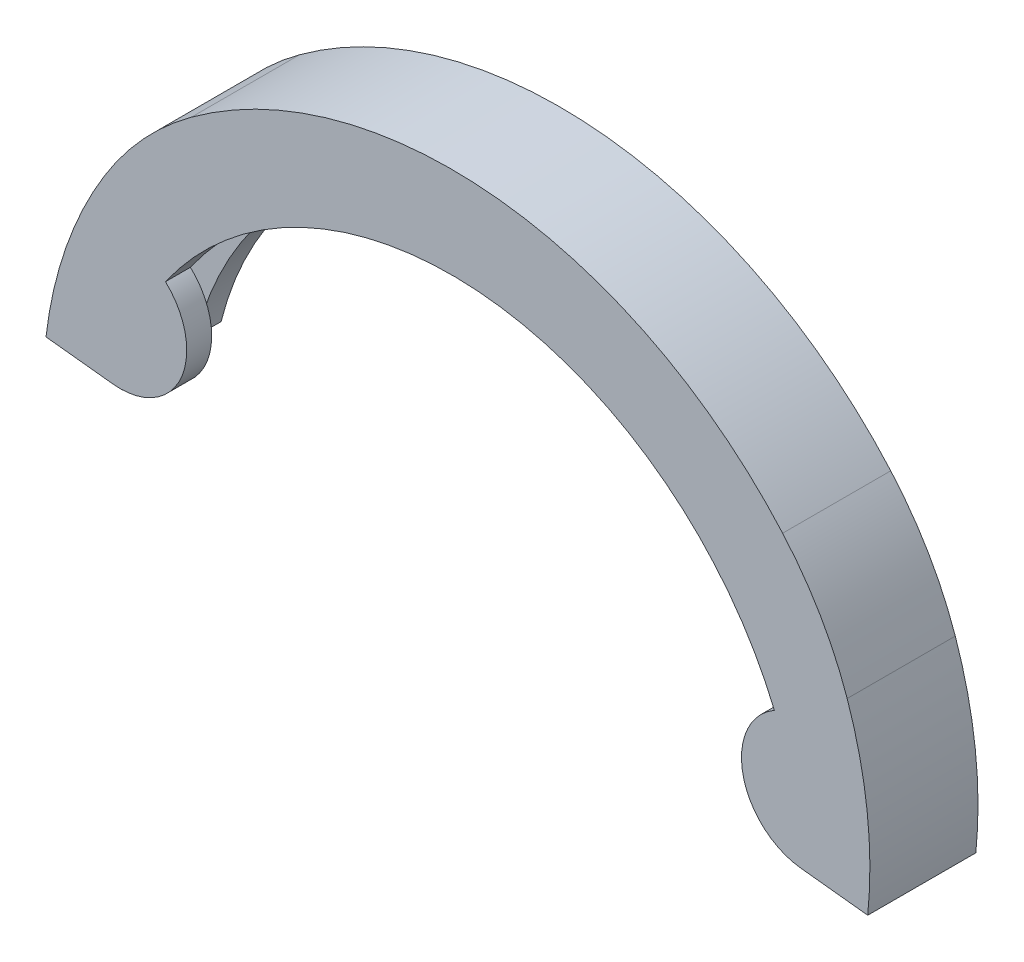
from build123d import *

# Parameters (mm, degrees)
SKETCH1_W                     = 50
SKETCH1_H                     = 7
REVOLVE5_ANGLE                = 167.5
SHELL2_T                      = 3
CUT_EXTRUDE3_DEPTH            = 77.072333999
CUT_EXTRUDE3_DEPTH_BACK       = 10
CUT_EXTRUDE4_DEPTH            = 77.072333999
CUT_EXTRUDE4_DEPTH_BACK       = 10
CUT_EXTRUDE_THIN1_DEPTH       = 77.072333999
CUT_EXTRUDE_THIN1_DEPTH_BACK  = 20
CUT_EXTRUDE_THIN2_DEPTH       = 77.072333999
CUT_EXTRUDE_THIN2_DEPTH_BACK  = 20
CUT_EXTRUDE_THIN3_DEPTH       = 76.000787866
CUT_EXTRUDE_THIN3_DEPTH_BACK  = 20
SKETCH18_R                    = 8
BOSS_EXTRUDE3_DEPTH           = 3
CUT_EXTRUDE_THIN11_DEPTH      = 76.000787866
CUT_EXTRUDE_THIN11_DEPTH_BACK = 20
CUT_EXTRUDE_THIN12_DEPTH      = 76.000787866
CUT_EXTRUDE_THIN12_DEPTH_BACK = 20
FILLET2_R                     = 40


with BuildPart() as part:
    # Sketch1 → Revolve5 (revolve)
    with BuildSketch(Plane(origin=(0, 0, 0), x_dir=(1, 0, 0), z_dir=(0, 1, 0))):
        with Locations((25, 3.5)):
            Rectangle(SKETCH1_W, SKETCH1_H)
    revolve(axis=Axis((0, 0, 0), (0, 0, 1)), revolution_arc=REVOLVE5_ANGLE)

    # Shell2
    shell2_openings = [part.faces().sort_by_distance(p)[0] for p in [
        (25, 0, -3.5),
        (-24.407400178, 5.410990348, -3.5),
    ]]
    offset(amount=SHELL2_T, openings=shell2_openings, kind=Kind.INTERSECTION)

    # Sketch11 → Cut-Extrude3 (cut, two sides: drawn at the far end of the back side and taken through both)
    with BuildSketch(Plane.XY.offset(3).offset(-CUT_EXTRUDE3_DEPTH_BACK)):
        Polygon((-295.067343662, 38.119573796), (-51.743688377, 11.471299539), (53, 0), (296.323655284, -26.648274258), (243.027106769, -513.295584826), (-348.363892177, -448.527736772), align=None)
    extrude(amount=CUT_EXTRUDE3_DEPTH + CUT_EXTRUDE3_DEPTH_BACK, mode=Mode.SUBTRACT)

    # Sketch12 → Cut-Extrude4 (cut, two sides: drawn at the far end of the back side and taken through both)
    with BuildSketch(Plane(origin=(0, 0, -10), x_dir=(-1, 0, 0), z_dir=(0, 0, -1)).offset(-CUT_EXTRUDE4_DEPTH_BACK)):
        Polygon((-296.323655284, -26.648274258), (-53, 0), (51.743688377, 11.471299539), (295.067343662, 38.119573796), (348.363892177, -448.527736772), (-243.027106769, -513.295584826), align=None)
    extrude(amount=CUT_EXTRUDE4_DEPTH + CUT_EXTRUDE4_DEPTH_BACK, mode=Mode.SUBTRACT)

    # Sketch13 → Cut-Extrude-Thin1 (cut, two sides: drawn at the far end of the back side and taken through both)
    with BuildSketch(Plane(origin=(0, 0, -10), x_dir=(-1, 0, 0), z_dir=(0, 0, -1)).offset(-CUT_EXTRUDE_THIN1_DEPTH_BACK)):
        Polygon((48.779244367, 11.146640118), (47.419699991, 23.560551191), (57.360263374, 24.64921994), (58.719807749, 12.235308866), align=None)
    extrude(amount=CUT_EXTRUDE_THIN1_DEPTH + CUT_EXTRUDE_THIN1_DEPTH_BACK, mode=Mode.SUBTRACT)

    # Sketch14 → Cut-Extrude-Thin2 (cut, two sides: drawn at the far end of the back side and taken through both)
    with BuildSketch(Plane(origin=(0, 0, -10), x_dir=(-1, 0, 0), z_dir=(0, 0, -1)).offset(-CUT_EXTRUDE_THIN2_DEPTH_BACK)):
        Polygon((-50.035555989, 0.324659421), (-51.39409796, 12.729417605), (-81.215788107, 9.46341136), (-79.857246136, -2.941346825), align=None)
    extrude(amount=CUT_EXTRUDE_THIN2_DEPTH + CUT_EXTRUDE_THIN2_DEPTH_BACK, mode=Mode.SUBTRACT)

    # Sketch15 → Cut-Extrude-Thin3 (cut, two sides: drawn at the far end of the back side and taken through both)
    with BuildSketch(Plane(origin=(0, 0, -10), x_dir=(-1, 0, 0), z_dir=(0, 0, -1)).offset(-CUT_EXTRUDE_THIN3_DEPTH_BACK)):
        with BuildLine():
            ThreePointArc((-41.982664634, 1.20659446), (-4.572408744, 41.750366205), (40.726353012, 10.264705079))
            Line((40.726353012, 10.264705079), (11.636100861, 2.93277288))
            ThreePointArc((11.636100861, 2.93277288), (-1.306402498, 11.928676059), (-11.995047038, 0.344741274))
            Line((-11.995047038, 0.344741274), (-41.982664634, 1.20659446))
        make_face()
    extrude(amount=CUT_EXTRUDE_THIN3_DEPTH + CUT_EXTRUDE_THIN3_DEPTH_BACK, mode=Mode.SUBTRACT)


with BuildPart() as body_2:
    # of the pieces the cut leaves, the one that is kept (cut_extrude_thin3_keep)
    add(part.part.solids().sort_by_distance((49.998919737, 0.328671743, 0))[0])

    # Sketch18 → Boss-Extrude3 (add)
    with BuildSketch(Plane.XY.offset(3)):
        with Locations((-39.855418013, 18.217155785)):
            Circle(SKETCH18_R)
        with Locations((42.853599633, 9.159045166)):
            Circle(SKETCH18_R)
    extrude(amount=-BOSS_EXTRUDE3_DEPTH)

    # Sketch26 → Cut-Extrude-Thin11 (cut, two sides: drawn at the far end of the back side and taken through both)
    with BuildSketch(Plane.XY.offset(3).offset(-CUT_EXTRUDE_THIN11_DEPTH_BACK)):
        with BuildLine():
            ThreePointArc((-48.779244367, 11.146640118), (-44.869380897, 25.502903795), (-36.885486711, 38.058650397))
            Line((-36.885486711, 38.058650397), (-51.966031339, 51.195513559))
            ThreePointArc((-51.966031339, 51.195513559), (-63.162508763, 33.587548061), (-68.645634797, 13.454568038))
            Line((-68.645634797, 13.454568038), (-48.779244367, 11.146640118))
        make_face()
    extrude(amount=CUT_EXTRUDE_THIN11_DEPTH + CUT_EXTRUDE_THIN11_DEPTH_BACK, mode=Mode.SUBTRACT)

    # Sketch27 → Cut-Extrude-Thin12 (cut, two sides: drawn at the far end of the back side and taken through both)
    with BuildSketch(Plane.XY.offset(3).offset(-CUT_EXTRUDE_THIN12_DEPTH_BACK)):
        with BuildLine():
            ThreePointArc((50.035555989, 0.324659421), (49.325636064, 15.186871666), (44.248552996, 29.173027916))
            Line((44.248552996, 29.173027916), (61.814966092, 38.73446771))
            ThreePointArc((61.814966092, 38.73446771), (68.93498104, 19.120520049), (69.93056067, -1.721993641))
            Line((69.93056067, -1.721993641), (50.035555989, 0.324659421))
        make_face()
    extrude(amount=CUT_EXTRUDE_THIN12_DEPTH + CUT_EXTRUDE_THIN12_DEPTH_BACK, mode=Mode.SUBTRACT)

    # Fillet2
    # the kernel refuses this fillet: 40 mm, written as the material it takes off along each edge
    with BuildSketch(Plane(origin=(-36.885486711, 38.058650397, -30.526100609), x_dir=(-0.5923211564074143, -0.8057019595807023, 0), z_dir=(0, 0, 1)), Plane(origin=(44.248552996, 29.173027916, 23.526100609), x_dir=(0.4038949588524026, -0.9148053684875357, 0), z_dir=(0, 0, -1))) as fillet2_piece_1:
        with BuildLine():
            CenterArc((4.906698725, 39.863332675), FILLET2_R, 252.499995648, 22.237662415)
            ThreePointArc((-7.121536153, 1.714655559), (-3.59042601, 0.734148493), (0, 0))
            ThreePointArc((0, 0), (4.105220122, -0.169822442), (8.210440244, 0))
        make_face()
    extrude(amount=54.052201219, mode=Mode.SUBTRACT)


solid = body_2.part
